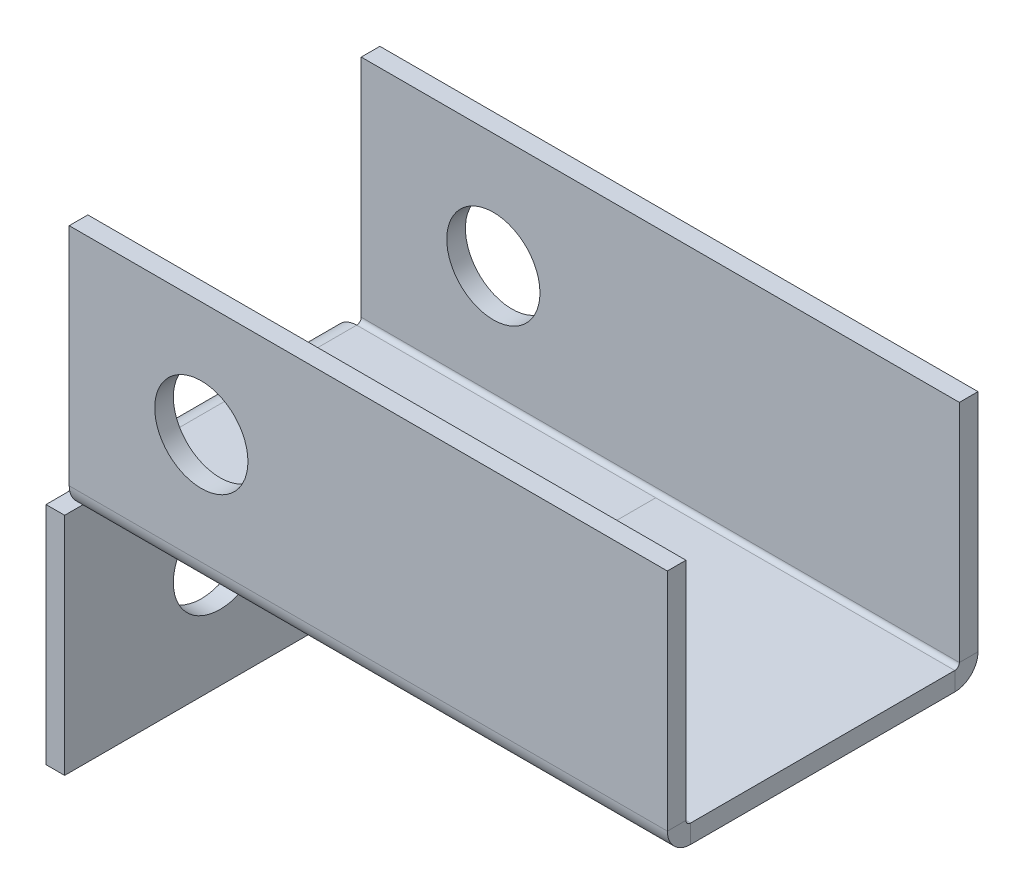
from build123d import *

# Parameters (mm, degrees)
SKETCH1_W                    = 100
SKETCH1_H                    = 50
BASE_FLANGE1_DEPTH           = 3
EDGE_FLANGE1_STRIP_W         = 13.4732
EDGE_FLANGE1_STRIP_H         = 3
EDGE_FLANGE1_STRIP_CUT_DEPTH = 50
EDGE_FLANGE1_DEPTH           = 50
EDGE_FLANGE2_START           = -50
EDGE_FLANGE2_DEPTH           = 100
EDGE_FLANGE2_2_DEPTH         = 3.7366
EDGE_FLANGE2_START_2         = -46.2634
EDGE_FLANGE2_3_DEPTH         = 96.2634
SKETCH15_R                   = 7.5
CUT_EXTRUDE1_DEPTH           = 82.240384046
CUT_EXTRUDE2_REACH           = 112.567
SKETCH16_R                   = 7.5


# Read off the part's stored shape, not the designer's step: Edge-Flange2
# Sheet-metal steps are written as plain solids
with BuildPart() as part:
    # Sketch1 → Base-Flange1 (new body)
    with BuildSketch(Plane(origin=(0, 0, 0), x_dir=(1, 0, 0), z_dir=(0, 1, 0))):
        Rectangle(SKETCH1_W, SKETCH1_H)
    extrude(amount=-BASE_FLANGE1_DEPTH)

    # Edge-Flange1 strip (across the edge) → Edge-Flange1 strip cut (cut)
    with BuildSketch(Plane(origin=(-50, -3, 25), x_dir=(1, 0, 0), z_dir=(0, 0, -1))):
        with Locations((-3, -1.5)):
            Rectangle(EDGE_FLANGE1_STRIP_W, EDGE_FLANGE1_STRIP_H)
    extrude(amount=EDGE_FLANGE1_STRIP_CUT_DEPTH, mode=Mode.SUBTRACT)

    # Edge-Flange1 section (across the edge) → Edge-Flange1 (add)
    with BuildSketch(Plane(origin=(-50, -3, 25), x_dir=(1, 0, 0), z_dir=(0, 0, -1))):
        with BuildLine():
            Line((0, 0.7366), (0, 37))
            Line((0, 37), (3, 37))
            Line((3, 37), (3, 0.7366))
            ThreePointArc((3, 0.7366), (3.215745145, 0.215745145), (3.7366, 0))
            Line((3.7366, 0), (3.7366, -3))
            ThreePointArc((3.7366, -3), (1.094424801, -1.905575199), (0, 0.7366))
        make_face()
    extrude(amount=EDGE_FLANGE1_DEPTH)

    # Edge-Flange2 outline → Edge-Flange2 (cut)
    with BuildSketch(Plane.YZ.offset(EDGE_FLANGE2_START)):
        with BuildLine():
            Line((-3, -21.2634), (-3.7366, -21.2634))
            Line((-3.7366, -21.2634), (-3.7366, -25))
            Line((-3.7366, -25), (0, -25))
            Line((0, -25), (0, -24.926677222))
            ThreePointArc((0, -24.926677222), (-2.154295979, -23.630867001), (-3, -21.2634))
        make_face()
        with BuildLine():
            Line((0, 25), (-3.7366, 25))
            Line((-3.7366, 25), (-3.7366, 21.2634))
            Line((-3.7366, 21.2634), (-3, 21.2634))
            ThreePointArc((-3, 21.2634), (-2.154295979, 23.630867001), (0, 24.926677222))
            Line((0, 24.926677222), (0, 25))
        make_face()
    extrude(amount=EDGE_FLANGE2_DEPTH, mode=Mode.SUBTRACT)

    # Edge-Flange2 2 outline → Edge-Flange2 2 (cut)
    with BuildSketch(Plane.YZ.offset(EDGE_FLANGE2_START)):
        with BuildLine():
            Line((0, -21.2634), (-3, -21.2634))
            ThreePointArc((-3, -21.2634), (-2.154295979, -23.630867001), (0, -24.926677222))
            Line((0, -24.926677222), (0, -21.2634))
        make_face()
        with BuildLine():
            ThreePointArc((0, 24.926677222), (-2.154295979, 23.630867001), (-3, 21.2634))
            Line((-3, 21.2634), (0, 21.2634))
            Line((0, 21.2634), (0, 24.926677222))
        make_face()
    extrude(amount=EDGE_FLANGE2_2_DEPTH, mode=Mode.SUBTRACT)

    # Edge-Flange2 3 outline → Edge-Flange2 3 (add)
    with BuildSketch(Plane.YZ.offset(EDGE_FLANGE2_START_2)):
        with BuildLine():
            ThreePointArc((0.7366, -22), (0.215745145, -21.784254855), (0, -21.2634))
            Line((0, -21.2634), (0, -24.926677222))
            ThreePointArc((0, -24.926677222), (0.36647982, -24.981624121), (0.7366, -25))
            Line((0.7366, -25), (37, -25))
            Line((37, -25), (37, -22))
            Line((37, -22), (0.7366, -22))
        make_face()
        with BuildLine():
            Line((0, 24.926677222), (0, 21.2634))
            ThreePointArc((0, 21.2634), (0.215745145, 21.784254855), (0.7366, 22))
            Line((0.7366, 22), (37, 22))
            Line((37, 22), (37, 25))
            Line((37, 25), (0.7366, 25))
            ThreePointArc((0.7366, 25), (0.36647982, 24.981624121), (0, 24.926677222))
        make_face()
    extrude(amount=EDGE_FLANGE2_3_DEPTH)

    # Sketch15 → Cut-Extrude1 (cut, through all)
    with BuildSketch(Plane.XY.offset(25)):
        with Locations((-25, 18.5)):
            Circle(SKETCH15_R)
    extrude(amount=-CUT_EXTRUDE1_DEPTH, mode=Mode.SUBTRACT)

    # Sketch16 → Cut-Extrude2 (cut, up to next)
    with BuildSketch(Plane.ZY.offset(50), mode=Mode.PRIVATE) as cut_extrude2_sk1:
        with Locations(Location((0, -21.8683, 0), (0, 0, 270))):
            Circle(SKETCH16_R)
    cut_extrude2_tool1 = extrude(cut_extrude2_sk1.sketch, amount=-CUT_EXTRUDE2_REACH, mode=Mode.PRIVATE) & part.part
    add(cut_extrude2_tool1.solids().sort_by_distance((-50, -21.8683, 0))[0], mode=Mode.SUBTRACT)


solid = part.part
